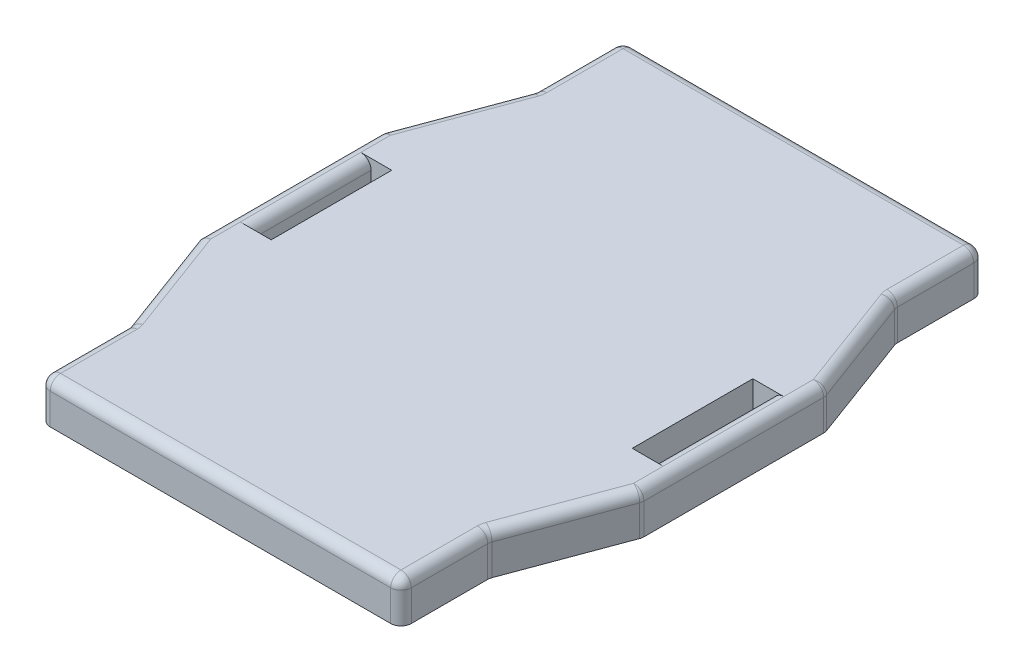
from build123d import *

# Parameters (mm, degrees)
SKETCH1_W           = 87.5
SKETCH1_H           = 141.3
BOSS_EXTRUDE1_DEPTH = 4
SKETCH1_3_W         = 87.5
SKETCH1_3_H         = 141.3
SKETCH1_3_W_2       = 75.5
SKETCH1_3_H_2       = 129.3
BOSS_EXTRUDE2_DEPTH = 6
BOSS_EXTRUDE3_DEPTH = 10
FILLET2_R           = 2.5


with BuildPart() as part:
    # Sketch1 → Boss-Extrude1 (new body)
    with BuildSketch(Plane(origin=(0, 0, 0), x_dir=(1, 0, 0), z_dir=(0, 1, 0))):
        Rectangle(SKETCH1_W, SKETCH1_H)
    extrude(amount=BOSS_EXTRUDE1_DEPTH)

    # Sketch1<3> → Boss-Extrude2 (add)
    with BuildSketch(Plane(origin=(0, 0, 0), x_dir=(1, 0, 0), z_dir=(0, 1, 0))):
        Rectangle(SKETCH1_3_W, SKETCH1_3_H)
        Rectangle(SKETCH1_3_W_2, SKETCH1_3_H_2, mode=Mode.SUBTRACT)
    extrude(amount=-BOSS_EXTRUDE2_DEPTH)

    # Sketch2 → Boss-Extrude3 (add)
    with BuildSketch(Plane(origin=(0, 4, 0), x_dir=(1, 0, 0), z_dir=(0, 1, 0))):
        Polygon((-43.75, 49.188592066), (-53.75, 22.225), (-53.75, -22.225), (-43.75, -49.188592066), (-43.75, -22.225), (-43.75, -14.605), (-48.75, -14.605), (-48.75, 14.605), (-43.75, 14.605), (-43.75, 22.225), align=None)
        Polygon((53.75, 22.225), (43.75, 22.225), (43.75, 14.605), (48.75, 14.605), (48.75, -14.605), (43.75, -14.605), (43.75, -22.225), (43.75, -49.188592066), (53.75, -22.225), align=None)
        Polygon((43.75, 49.188592066), (43.75, 22.225), (53.75, 22.225), align=None)
    extrude(amount=-BOSS_EXTRUDE3_DEPTH)

    # Fillet2
    fillet2_edges = [part.edges().sort_by_distance(p)[0] for p in [
        (0, 4, 70.65),
        (43.75, 4, -59.919296033),
        (-43.75, 4, 59.919296033),
        (0, 4, -70.65),
        (-48.75, 4, -35.706796033),
        (-53.75, -1, -22.225),
        (-43.75, -1, -49.188592066),
        (-43.75, -1, 49.188592066),
        (-53.75, 4, 0),
        (-48.75, 4, 35.706796033),
        (-48.75, 4, 0),
        (43.75, 4, 59.919296033),
        (43.75, -1, -49.188592066),
        (53.75, 4, 0),
        (53.75, -1, -22.225),
        (48.75, 4, 35.706796033),
        (53.75, -1, 22.225),
        (43.75, -1, 49.188592066),
        (48.75, 4, 0),
        (-43.75, 4, -59.919296033),
        (48.75, 4, -35.706796033),
        (43.75, -1, -70.65),
        (43.75, -1, 70.65),
        (-43.75, -1, 70.65),
        (-43.75, -1, -70.65),
    ]]
    fillet(fillet2_edges, radius=FILLET2_R - 0.0001)  # a hair under: the kernel refuses the full size


solid = part.part
